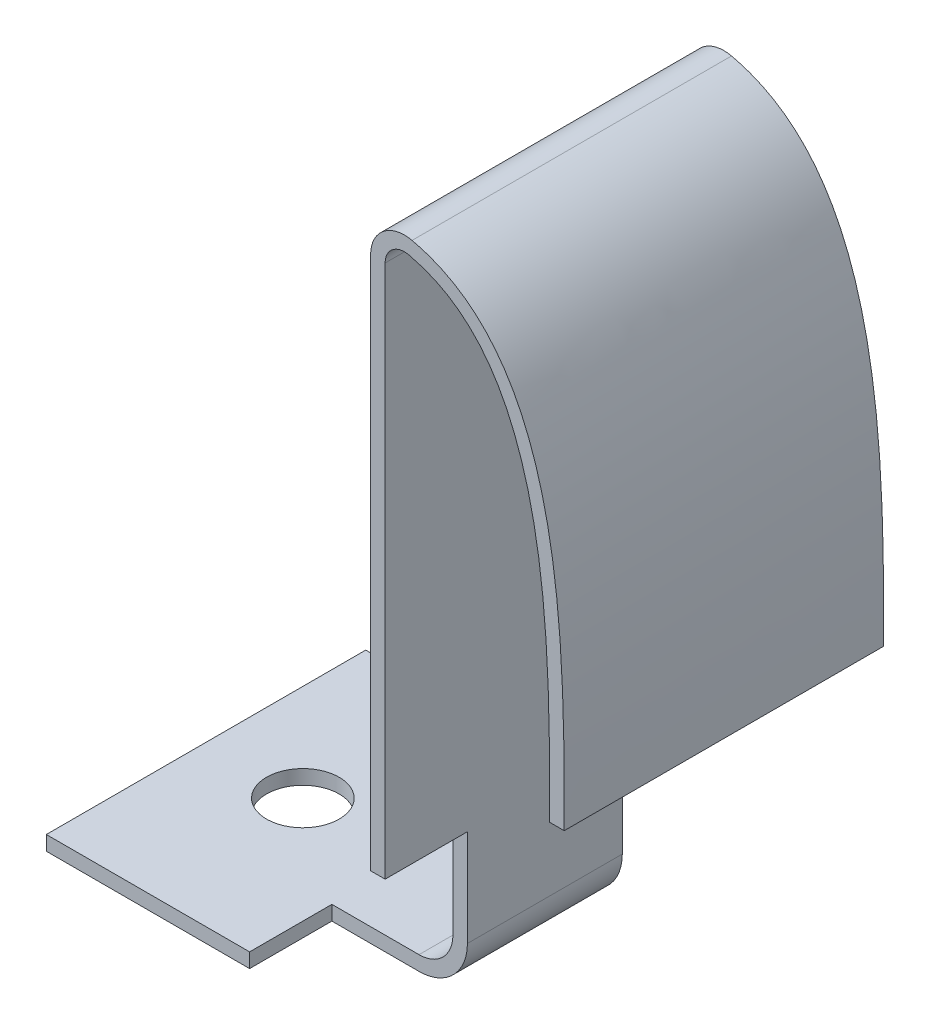
from build123d import *

# Parameters (mm, degrees)
BOSS_EXTRUDE1_START = -3.3
BOSS_EXTRUDE1_DEPTH = 6.6
SKETCH2_W           = 3.280173546
SKETCH2_H           = 3.327606579
CUT_EXTRUDE1_DEPTH  = 1.7
SKETCH3_R           = 0.75
CUT_EXTRUDE2_DEPTH  = 17.244469999


# Read off the part's stored shape, not the designer's step: Boss-Extrude1
with BuildPart() as part:
    # Boss-Extrude1 outline → Boss-Extrude1 (new body)
    with BuildSketch(Plane.XY.offset(BOSS_EXTRUDE1_START)):
        with BuildLine():
            Line((-6.7, 0), (-6.7, -0.3))
            Line((-6.7, -0.3), (-0.7, -0.3))
            ThreePointArc((-0.7, -0.3), (0.007106781, -0.007106781), (0.3, 0.7))
            Line((0.3, 0.7), (0.3, 13.725768681))
            ThreePointArc((0.3, 13.725768681), (0.450724342, 14.038597142), (0.789308232, 14.115671283))
            add(Edge.make_bspline(
                [(0.789308232, 14.115671283), (0.961165962, 14.076306812), (1.306452594, 13.962853815), (1.880223168, 13.63882047), (2.704664131, 12.811779549), (3.414638461, 10.952808053), (3.654025925, 8.623480967), (3.700475397, 6.735358197), (3.7, 5.862977701), (3.7, 5.417821782)],
                knots=[0, 0, 0, 0, 0.0625, 0.125, 0.25, 0.5, 0.75, 0.875, 1, 1, 1, 1], degree=3))
            Line((3.7, 5.417821782), (4, 5.417821782))
            add(Edge.make_bspline(
                [(4, 5.417821782), (4, 8.840093463), (4.016269814, 13.684296285), (0.856289406, 14.408098235)],
                knots=[0, 0, 0, 0, 1, 1, 1, 1], degree=3))
            ThreePointArc((0.856289406, 14.408098235), (0.263767599, 14.273218489), (0, 13.725768681))
            Line((0, 13.725768681), (0, 0.7))
            ThreePointArc((0, 0.7), (-0.205025253, 0.205025253), (-0.7, 0))
            Line((-0.7, 0), (-6.7, 0))
        make_face()
    extrude(amount=BOSS_EXTRUDE1_DEPTH)

    # Sketch2 → Cut-Extrude1 (cut)
    with BuildSketch(Plane.XY.offset(3.3)):
        with Locations((-0.859913227, 1.036196711)):
            Rectangle(SKETCH2_W, SKETCH2_H)
    cut_extrude1 = extrude(amount=-CUT_EXTRUDE1_DEPTH, mode=Mode.SUBTRACT)

    # Mirror1: Cut-Extrude1 across plane
    add(cut_extrude1.mirror(Plane.XY), mode=Mode.SUBTRACT)

    # Sketch3 → Cut-Extrude2 (cut, through all)
    with BuildSketch(Plane(origin=(0, 0, 0), x_dir=(1, 0, 0), z_dir=(0, 1, 0))):
        with Locations(Location((-4.7, 0, 0), (0, 0, 180))):
            Circle(SKETCH3_R)
    extrude(amount=-CUT_EXTRUDE2_DEPTH, mode=Mode.SUBTRACT)


solid = part.part
